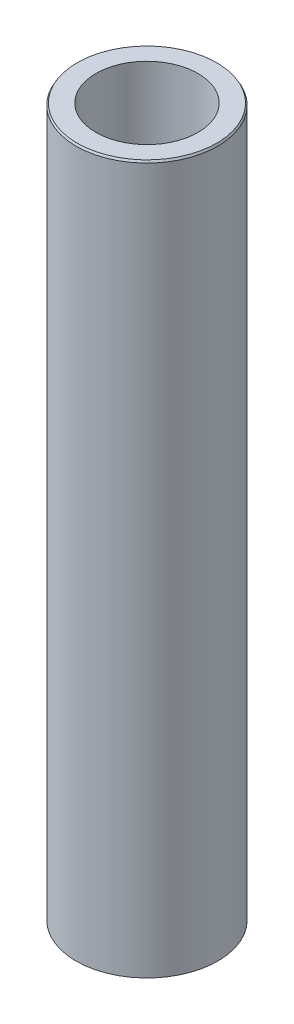
from build123d import *
from OCP.BRepFilletAPI import BRepFilletAPI_MakeChamfer

# Parameters (mm, degrees)
SKETCH1_R           = 60
BOSS_EXTRUDE1_DEPTH = 600
SKETCH2_R           = 43.239378985
CUT_EXTRUDE1_DEPTH  = 606.970296302
CHAMFER1_SIZE       = 1.674878005
CHAMFER1_SIZE2      = 0.966991267


with BuildPart() as part:
    # Sketch1 → Boss-Extrude1 (new body)
    with BuildSketch(Plane(origin=(0, 0, 0), x_dir=(1, 0, 0), z_dir=(0, 1, 0))):
        Circle(SKETCH1_R)
    extrude(amount=BOSS_EXTRUDE1_DEPTH)

    # Sketch2 → Cut-Extrude1 (cut, through all)
    with BuildSketch(Plane(origin=(0, 0, 0), x_dir=(1, 0, 0), z_dir=(0, 1, 0))):
        Circle(SKETCH2_R)
    extrude(amount=CUT_EXTRUDE1_DEPTH, mode=Mode.SUBTRACT)

    # Chamfer1: one chamfer whose edges measure the first distance from different faces: ONE call of the kernel's chamfer builder (chamfer() names one face for all edges)
    chamfer1_edges_1 = [part.edges().sort_by_distance(p)[0] for p in [
        (-60, 600, 0),
    ]]
    chamfer1_side_1 = [part.faces().sort_by_distance(p)[0] for p in [
        (-60, 300, 0),
    ]]
    chamfer1_edges_2 = [part.edges().sort_by_distance(p)[0] for p in [
        (-60, 0, 0),
    ]]
    chamfer1_side_2 = [part.faces().sort_by_distance(p)[0] for p in [
        (-58.302943725, 0, 0),
    ]]
    chamfer1 = BRepFilletAPI_MakeChamfer(part.part.solid().wrapped)
    for e in chamfer1_edges_1:
        chamfer1.Add(CHAMFER1_SIZE, CHAMFER1_SIZE2, e.wrapped, chamfer1_side_1[0].wrapped)  # the first distance lies on this face
    for e in chamfer1_edges_2:
        chamfer1.Add(CHAMFER1_SIZE, CHAMFER1_SIZE2, e.wrapped, chamfer1_side_2[0].wrapped)  # the first distance lies on this face
    add(Compound.cast(chamfer1.Shape()), mode=Mode.REPLACE)


solid = part.part
